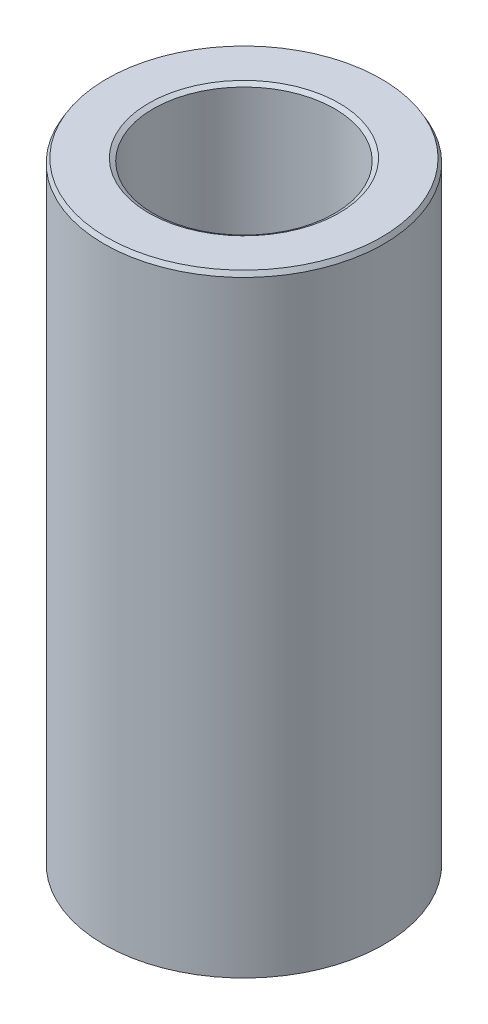
from build123d import *
from OCP.BRepFilletAPI import BRepFilletAPI_MakeChamfer

# Parameters (mm, degrees)
SKETCH1_R           = 57.5
BOSS_EXTRUDE1_DEPTH = 252.346503881
SKETCH2_R           = 37.295583244
CUT_EXTRUDE1_DEPTH  = 266.124985659
CHAMFER1_SIZE       = 1.843413791
CHAMFER1_SIZE2      = 1.064295449


with BuildPart() as part:
    # Sketch1 → Boss-Extrude1 (new body)
    with BuildSketch(Plane(origin=(0, 0, 0), x_dir=(1, 0, 0), z_dir=(0, 1, 0))):
        Circle(SKETCH1_R)
    extrude(amount=BOSS_EXTRUDE1_DEPTH)

    # Sketch2 → Cut-Extrude1 (cut, through all)
    with BuildSketch(Plane(origin=(0, 0, 0), x_dir=(1, 0, 0), z_dir=(0, 1, 0))):
        Circle(SKETCH2_R)
    extrude(amount=CUT_EXTRUDE1_DEPTH, mode=Mode.SUBTRACT)

    # Chamfer1: one chamfer whose edges measure the first distance from different faces: ONE call of the kernel's chamfer builder (chamfer() names one face for all edges)
    chamfer1_edges_1 = [part.edges().sort_by_distance(p)[0] for p in [
        (-37.295583244, 252.346503881, 0),
    ]]
    chamfer1_side_1 = [part.faces().sort_by_distance(p)[0] for p in [
        (-55.873654403, 252.346503881, 0),
    ]]
    chamfer1_edges_2 = [part.edges().sort_by_distance(p)[0] for p in [
        (-37.295583244, 0, 0),
    ]]
    chamfer1_side_2 = [part.faces().sort_by_distance(p)[0] for p in [
        (-37.295583244, 126.17325194, 0),
    ]]
    chamfer1_edges_3 = [part.edges().sort_by_distance(p)[0] for p in [
        (-57.5, 0, 0),
    ]]
    chamfer1_side_3 = [part.faces().sort_by_distance(p)[0] for p in [
        (-55.873654403, 0, 0),
    ]]
    chamfer1_edges_4 = [part.edges().sort_by_distance(p)[0] for p in [
        (-57.5, 252.346503881, 0),
    ]]
    chamfer1_side_4 = [part.faces().sort_by_distance(p)[0] for p in [
        (-57.5, 126.17325194, 0),
    ]]
    chamfer1 = BRepFilletAPI_MakeChamfer(part.part.solid().wrapped)
    for e in chamfer1_edges_1:
        chamfer1.Add(CHAMFER1_SIZE, CHAMFER1_SIZE2, e.wrapped, chamfer1_side_1[0].wrapped)  # the first distance lies on this face
    for e in chamfer1_edges_2:
        chamfer1.Add(CHAMFER1_SIZE, CHAMFER1_SIZE2, e.wrapped, chamfer1_side_2[0].wrapped)  # the first distance lies on this face
    for e in chamfer1_edges_3:
        chamfer1.Add(CHAMFER1_SIZE, CHAMFER1_SIZE2, e.wrapped, chamfer1_side_3[0].wrapped)  # the first distance lies on this face
    for e in chamfer1_edges_4:
        chamfer1.Add(CHAMFER1_SIZE, CHAMFER1_SIZE2, e.wrapped, chamfer1_side_4[0].wrapped)  # the first distance lies on this face
    add(Compound.cast(chamfer1.Shape()), mode=Mode.REPLACE)


solid = part.part
